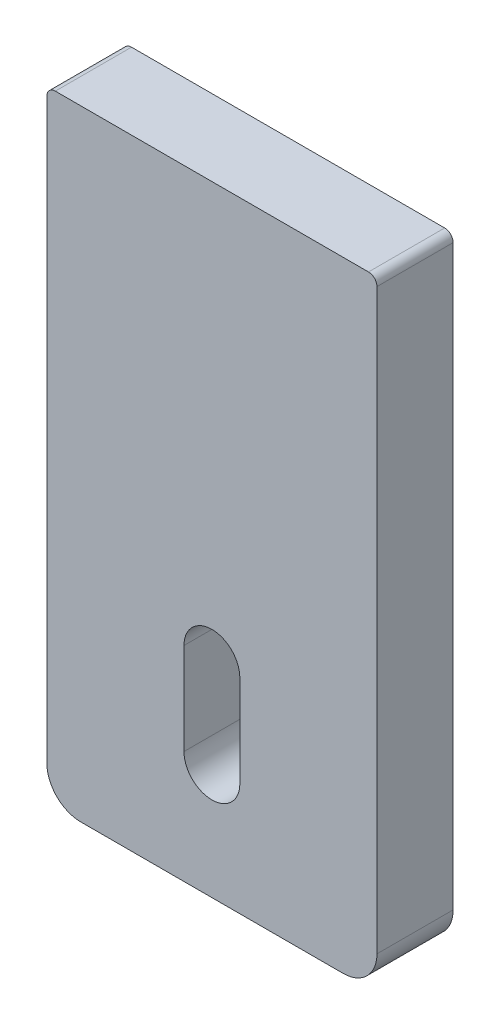
from build123d import *

# Parameters (mm, degrees)
SKETCH1_W           = 19.5
SKETCH1_H           = 36.635639425
BOSS_EXTRUDE1_DEPTH = 5
FILLET1_R           = 2
SKETCH2_W           = 19.5
SKETCH2_H           = 10
CUT_EXTRUDE1_DEPTH  = 0.5
FILLET2_R           = 0.5
CHAMFER1_SIZE       = 0.5


with BuildPart() as part:
    # Sketch1 → Boss-Extrude1 (new body)
    with BuildSketch(Plane.XY):
        with Locations((0, -18.317819713)):
            Rectangle(SKETCH1_W, SKETCH1_H)
        with BuildLine():
            Line((-1.65, -29.985639425), (-1.65, -24.560298466))
            ThreePointArc((-1.65, -24.560298466), (0, -22.910298466), (1.65, -24.560298466))
            Line((1.65, -24.560298466), (1.65, -29.985639425))
            ThreePointArc((1.65, -29.985639425), (0, -31.635639425), (-1.65, -29.985639425))
        make_face(mode=Mode.SUBTRACT)
    extrude(amount=BOSS_EXTRUDE1_DEPTH)

    # Fillet1
    fillet1_edges = [part.edges().sort_by_distance(p)[0] for p in [
        (-9.75, -36.635639425, 2.5),
        (9.75, -36.635639425, 2.5),
    ]]
    fillet(fillet1_edges, radius=FILLET1_R)

    # Sketch2 → Cut-Extrude1 (cut)
    with BuildSketch(Plane.XY):
        with Locations((0, -5)):
            Rectangle(SKETCH2_W, SKETCH2_H)
    extrude(amount=CUT_EXTRUDE1_DEPTH, mode=Mode.SUBTRACT)

    # Fillet2
    fillet2_edges = [part.edges().sort_by_distance(p)[0] for p in [
        (9.75, 0, 2.75),
        (-9.75, 0, 2.75),
    ]]
    fillet(fillet2_edges, radius=FILLET2_R)

    # Chamfer1
    chamfer1_edges = [part.edges().sort_by_distance(p)[0] for p in [
        (-9.75, -22.317819713, 0),
        (-9.164213562, -36.049852987, 0),
        (0, -36.635639425, 0),
        (9.164213562, -36.049852987, 0),
        (9.75, -22.317819713, 0),
    ]]
    chamfer(chamfer1_edges, length=CHAMFER1_SIZE)


solid = part.part
